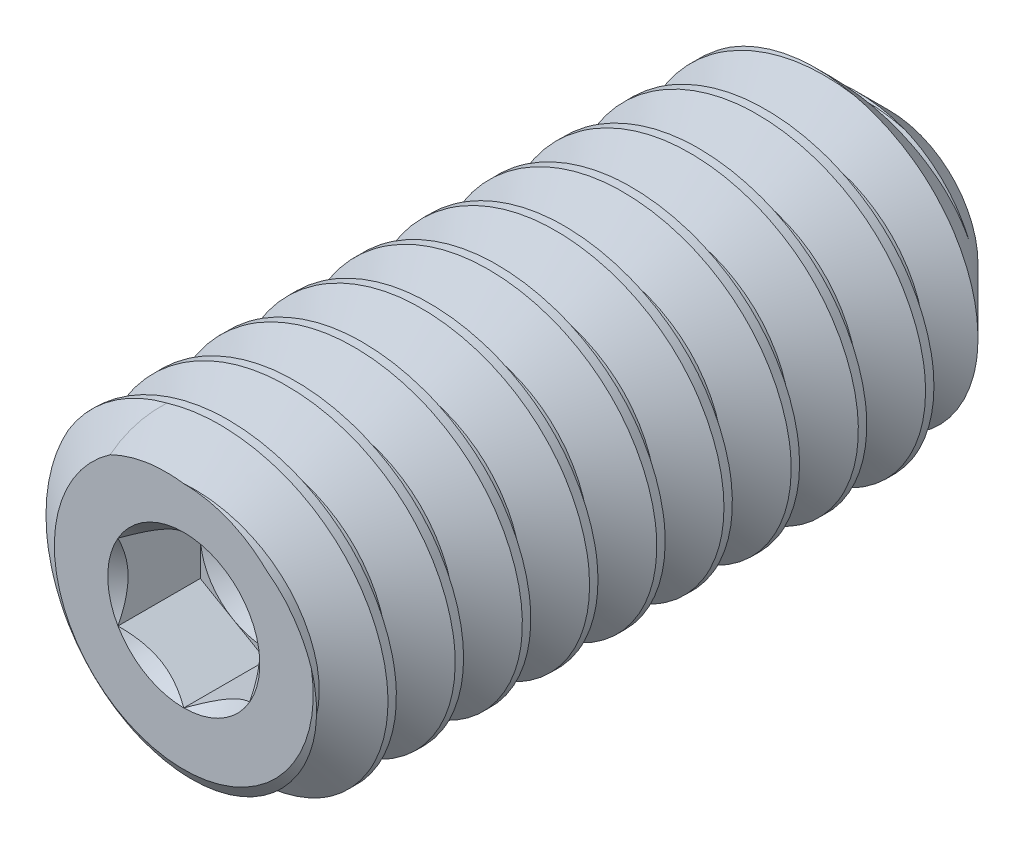
from build123d import *

# Parameters (mm, degrees)
CUT_SWEEP2_PITCH    = 0.453571429
CUT_EXTRUDE10_DEPTH = 0.555625


with BuildPart() as part:
    # Sketch22 → Revolve1 (revolve)
    with BuildSketch(Plane(origin=(0, 0, 0), x_dir=(0, 0, -1), z_dir=(1, 0, 0)), mode=Mode.PRIVATE) as revolve1_sk:
        Polygon((-2.201446284, 0), (-2.201446284, 0.87376), (-2.048492949, 1.0922), (2.067340987, 1.0922), (2.561053716, 0.598487271), (2.201446284, 0), align=None)
    revolve(revolve1_sk.sketch.rotate(Axis((0, 0, -2.201446284), (0, 0, -1)), 180), axis=Axis((0, 0, -2.201446284), (0, 0, -1)))

    # Cut-Sweep2: the profile of Sketch28 profile screwed along a right-hand helix of 11.5 turns, 6 arcs to a turn; built about Z, then put on its axis
    cut_sweep2_z = Axis((0, 0, 0), (0, 0, 1))
    cut_sweep2_corners = [(1.0925, 0, 0.000173205), (1.0925, 0, -0.397048205), (0.797596715, 0, -0.226785714), (0.797596715, 0, -0.170089286)]
    with BuildLine(mode=Mode.PRIVATE) as cut_sweep2_profile:
        Line(cut_sweep2_corners[0], cut_sweep2_corners[1])
        Line(cut_sweep2_corners[1], cut_sweep2_corners[2])
        Line(cut_sweep2_corners[2], cut_sweep2_corners[3])
        Line(cut_sweep2_corners[3], cut_sweep2_corners[0])
    cut_sweep2_cap = Face(cut_sweep2_profile.wire())
    cut_sweep2_turn_angles = [0, 30, 60, 90, 120, 150, 180, 210, 240, 270, 300, 330, 360]
    cut_sweep2_turn_weights = [1, 0.8660254037844387, 1, 0.8660254037844387, 1, 0.8660254037844387, 1, 0.8660254037844387, 1, 0.8660254037844387, 1, 0.8660254037844387, 1]
    cut_sweep2_turn_rails = [Edge.make_bspline([Vector(p[0], p[1], 0).rotate(cut_sweep2_z, cut_sweep2_turn_angles[k]) / cut_sweep2_turn_weights[k] + Vector(0, 0, p[2] + CUT_SWEEP2_PITCH * cut_sweep2_turn_angles[k] / 360) for k in range(13)], [0, 0, 0, 1, 1, 2, 2, 3, 3, 4, 4, 5, 5, 6, 6, 6], 2, cut_sweep2_turn_weights) for p in cut_sweep2_corners]
    cut_sweep2_turn_sides = [Face.make_surface_from_curves(cut_sweep2_turn_rails[p[0]], cut_sweep2_turn_rails[p[1]]) for p in [(0, 1), (1, 2), (2, 3), (3, 0)]]
    cut_sweep2_last_angles = [3960, 3990, 4020, 4050, 4080, 4110, 4140]
    cut_sweep2_last_weights = [1, 0.8660254037844387, 1, 0.8660254037844387, 1, 0.8660254037844108, 1]
    cut_sweep2_last_rails = [Edge.make_bspline([Vector(p[0], p[1], 0).rotate(cut_sweep2_z, cut_sweep2_last_angles[k]) / cut_sweep2_last_weights[k] + Vector(0, 0, p[2] + CUT_SWEEP2_PITCH * cut_sweep2_last_angles[k] / 360) for k in range(7)], [0, 0, 0, 1, 1, 2, 2, 3, 3, 3], 2, cut_sweep2_last_weights) for p in cut_sweep2_corners]
    cut_sweep2_last_sides = [Face.make_surface_from_curves(cut_sweep2_last_rails[p[0]], cut_sweep2_last_rails[p[1]]) for p in [(0, 1), (1, 2), (2, 3), (3, 0)]]
    cut_sweep2 = Plane(origin=(0, 0, -2.561053716), x_dir=(0, 1, 0), z_dir=(0, 0, 1)) * Solid(Shell([*[p.moved(Location((0, 0, CUT_SWEEP2_PITCH * i))) for i in range(11) for p in cut_sweep2_turn_sides], *cut_sweep2_last_sides, cut_sweep2_cap, cut_sweep2_cap.rotate(cut_sweep2_z, 4140).moved(Location((0, 0, CUT_SWEEP2_PITCH * 4140 / 360)))]))
    add(cut_sweep2, mode=Mode.SUBTRACT)

    # Sketch23 → Cut-Extrude10 (cut)
    with BuildSketch(Plane.XY.offset(2.201446284)):
        Polygon((0, 0.513264389), (-0.4445, 0.256632195), (-0.4445, -0.256632195), (0, -0.513264389), (0.4445, -0.256632195), (0.4445, 0.256632195), align=None)
    extrude(amount=-CUT_EXTRUDE10_DEPTH, mode=Mode.SUBTRACT)

    # Cut-Extrude11 cone 1 section (through the dimple's axis) → Cut-Extrude11 (revolve, cut)
    with BuildSketch(Plane(origin=(0, 0, 2.201446284), x_dir=(0, -1, 0), z_dir=(1, 0, 0))):
        Polygon((0, 0), (0.513264389, 0), (0, 0.513264389), align=None)
    revolve(axis=Axis((0, 0, 2.201446284), (0, 0, -1)), mode=Mode.SUBTRACT)

    # Cut-Extrude12 cone 1 section (through the dimple's axis) → Cut-Extrude12 (revolve, cut)
    with BuildSketch(Plane(origin=(0, 0, 1.645821284), x_dir=(0, -1, 0), z_dir=(1, 0, 0))):
        Polygon((0, 0), (0.4445, 0), (0, 0.256632195), align=None)
    revolve(axis=Axis((0, 0, 1.645821284), (0, 0, -1)), mode=Mode.SUBTRACT)


solid = part.part
